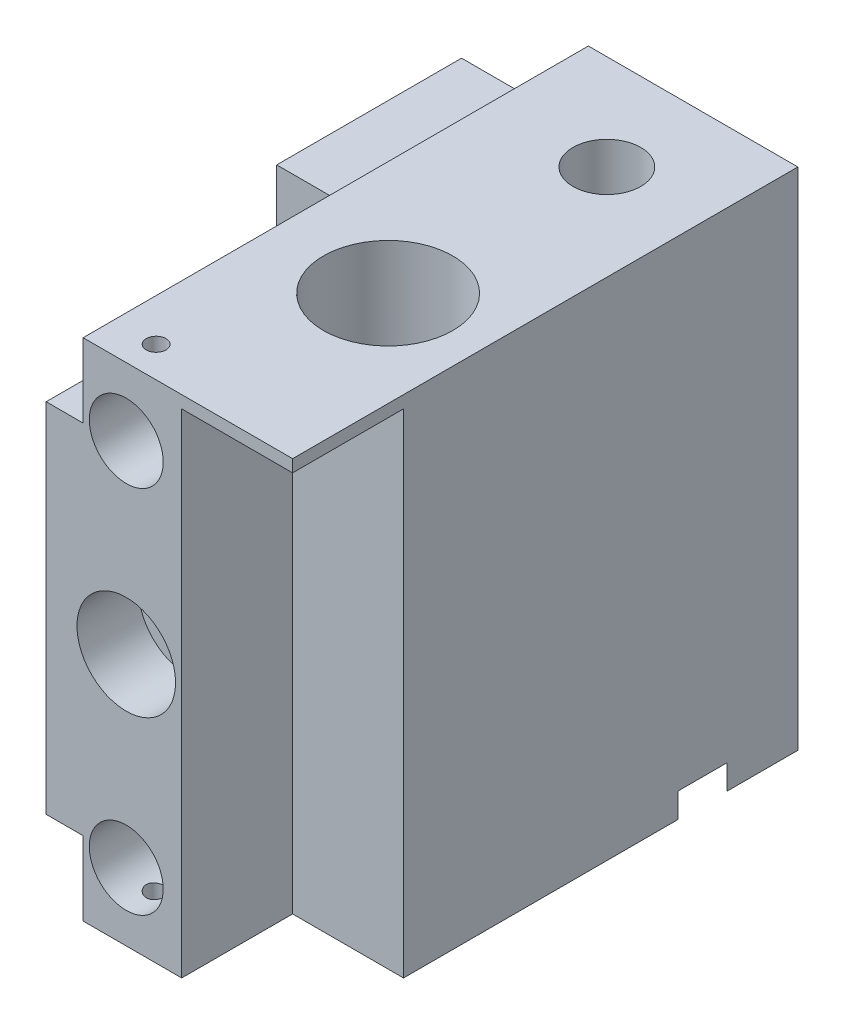
from build123d import *
from build123d.topology import SkipClean

# Parameters (mm, degrees)
SKETCH1_W           = 40
SKETCH1_H           = 82
SKETCH1_R           = 5.5
SKETCH1_R_2         = 6
BOSS_EXTRUDE1_DEPTH = 12
BOSS_EXTRUDE2_START = 70
SKETCH2_W           = 40
SKETCH2_H           = 82
SKETCH2_R           = 5.5
BOSS_EXTRUDE2_DEPTH = 70
SKETCH3_R           = 1.6
CUT_EXTRUDE1_DEPTH  = 10
CUT_EXTRUDE2_START  = -10
SKETCH4_R           = 1.6
CUT_EXTRUDE2_DEPTH  = 10
SKETCH5_R           = 10.5
SKETCH5_R_2         = 5.5
CUT_EXTRUDE3_DEPTH  = 100
SKETCH6_R           = 16
CUT_EXTRUDE4_DEPTH  = 4
SKETCH19_R          = 8.05
CUT_EXTRUDE17_DEPTH = 16
SKETCH12_R          = 1.2
CUT_EXTRUDE12_DEPTH = 12
SKETCH13_W          = 20
SKETCH13_H          = 70
BOSS_EXTRUDE3_DEPTH = 30
CUT_EXTRUDE14_DEPTH = 115
SKETCH22_W          = 18
SKETCH22_H          = 18
CUT_EXTRUDE18_DEPTH = 80
SKETCH23_R          = 8
CUT_EXTRUDE19_DEPTH = 10
SKETCH24_R          = 10
CUT_EXTRUDE20_DEPTH = 2
SKETCH25_R          = 2.5
CUT_EXTRUDE21_DEPTH = 25


with BuildPart() as part:
    # Sketch1 → Boss-Extrude1 (new body)
    with BuildSketch(Plane.XY):
        with Locations((-20, -41)):
            Rectangle(SKETCH1_W, SKETCH1_H)
        with Locations((-27, -41)):
            Circle(SKETCH1_R, mode=Mode.SUBTRACT)
        with Locations((-27, -11)):
            Circle(SKETCH1_R_2, mode=Mode.SUBTRACT)
        with Locations((-27, -71)):
            Circle(SKETCH1_R_2, mode=Mode.SUBTRACT)
    extrude(amount=BOSS_EXTRUDE1_DEPTH)

    # Sketch2 → Boss-Extrude2 (add)
    with SkipClean():  # the faces are left unmerged after this step: merging them gives an invalid solid
        with BuildSketch(Plane(origin=(0, 0, 0), x_dir=(-1, 0, 0), z_dir=(0, 0, -1)).offset(BOSS_EXTRUDE2_START)):
            with Locations((20, -41)):
                Rectangle(SKETCH2_W, SKETCH2_H)
            with Locations((27, -41)):
                Circle(SKETCH2_R, mode=Mode.SUBTRACT)
        extrude(amount=-BOSS_EXTRUDE2_DEPTH)

    # Sketch3 → Cut-Extrude1 (cut)
    with SkipClean():  # the faces are left unmerged after this step: merging them gives an invalid solid
        with BuildSketch(Plane(origin=(0, 0, 0), x_dir=(1, 0, 0), z_dir=(0, 1, 0))):
            with Locations((-27.154767421, -7)):
                Circle(SKETCH3_R)
        extrude(amount=-CUT_EXTRUDE1_DEPTH, mode=Mode.SUBTRACT)

    # Sketch4 → Cut-Extrude2 (cut)
    with SkipClean():  # the faces are left unmerged after this step: merging them gives an invalid solid
        with BuildSketch(Plane.XZ.offset(82).offset(CUT_EXTRUDE2_START)):
            with Locations((-27.154767421, 7)):
                Circle(SKETCH4_R)
        extrude(amount=CUT_EXTRUDE2_DEPTH, mode=Mode.SUBTRACT)

    # Sketch5 → Cut-Extrude3 (cut)
    with SkipClean():  # the faces are left unmerged after this step: merging them gives an invalid solid
        with BuildSketch(Plane(origin=(0, 0, 0), x_dir=(1, 0, 0), z_dir=(0, 1, 0))):
            with Locations((-15.5, 19)):
                Circle(SKETCH5_R)
            with Locations((-15.5, 54.5)):
                Circle(SKETCH5_R_2)
        extrude(amount=-CUT_EXTRUDE3_DEPTH, mode=Mode.SUBTRACT)

    # Sketch6 → Cut-Extrude4 (cut)
    with SkipClean():  # the faces are left unmerged after this step: merging them gives an invalid solid
        with BuildSketch(Plane(origin=(0, -82, 0), x_dir=(1, 0, 0), z_dir=(0, 1, 0))):
            with Locations((-15.5, 54.5)):
                Circle(SKETCH6_R)
        extrude(amount=CUT_EXTRUDE4_DEPTH, mode=Mode.SUBTRACT)

    # Sketch19 → Cut-Extrude17 (cut)
    with SkipClean():  # the faces are left unmerged after this step: merging them gives an invalid solid
        with BuildSketch(Plane(origin=(0, -78, 0), x_dir=(-1, 0, 0), z_dir=(0, -1, 0))):
            with Locations((15.5, 54.5)):
                Circle(SKETCH19_R)
        extrude(amount=-CUT_EXTRUDE17_DEPTH, mode=Mode.SUBTRACT)

    # Sketch12 → Cut-Extrude12 (cut)
    with SkipClean():  # the faces are left unmerged after this step: merging them gives an invalid solid
        with BuildSketch(Plane(origin=(0, -78, 0), x_dir=(-1, 0, 0), z_dir=(0, -1, 0))):
            with Locations((11.517229373, 43.180214749)):
                Circle(SKETCH12_R)
            with Locations((26.819785251, 50.517229373)):
                Circle(SKETCH12_R)
            with Locations((19.482770627, 65.819785251)):
                Circle(SKETCH12_R)
            with Locations((4.180214749, 58.482770627)):
                Circle(SKETCH12_R)
        extrude(amount=-CUT_EXTRUDE12_DEPTH, mode=Mode.SUBTRACT)

    # Sketch13 → Boss-Extrude3 (add)
    with SkipClean():  # the faces are left unmerged after this step: merging them gives an invalid solid
        with BuildSketch(Plane(origin=(0, 0, -70), x_dir=(-1, 0, 0), z_dir=(0, 0, -1))):
            with Locations((50, -35)):
                Rectangle(SKETCH13_W, SKETCH13_H)
        extrude(amount=-BOSS_EXTRUDE3_DEPTH)

    # Sketch15 → Cut-Extrude14 (cut)
    with SkipClean():  # the faces are left unmerged after this step: merging them gives an invalid solid
        with BuildSketch(Plane(origin=(0, 0, -70), x_dir=(-1, 0, 0), z_dir=(0, 0, -1))):
            Polygon((34, 0), (34, -12), (54.581085422, -12), (54.581085422, -70), (34, -70), (34, -82), (77.520554958, -82), (77.520554958, 0), align=None)
        extrude(amount=-CUT_EXTRUDE14_DEPTH, mode=Mode.SUBTRACT)

    # Sketch22 → Cut-Extrude18 (cut)
    with SkipClean():  # the faces are left unmerged after this step: merging them gives an invalid solid
        with BuildSketch(Plane.XZ.offset(82)):
            with Locations((-9, 3)):
                Rectangle(SKETCH22_W, SKETCH22_H)
        extrude(amount=-CUT_EXTRUDE18_DEPTH, mode=Mode.SUBTRACT)

    # Sketch23 → Cut-Extrude19 (cut)
    with SkipClean():  # the faces are left unmerged after this step: merging them gives an invalid solid
        with BuildSketch(Plane.XY.offset(12)):
            with Locations((-27, -41)):
                Circle(SKETCH23_R)
        extrude(amount=-CUT_EXTRUDE19_DEPTH, mode=Mode.SUBTRACT)

    # Sketch24 → Cut-Extrude20 (cut)
    with BuildSketch(Plane(origin=(0, 0, -70), x_dir=(-1, 0, 0), z_dir=(0, 0, -1))):
        with Locations((27, -41)):
            Circle(SKETCH24_R)
    extrude(amount=-CUT_EXTRUDE20_DEPTH, mode=Mode.SUBTRACT)

    # Sketch25 → Cut-Extrude21 (cut)
    with BuildSketch(Plane(origin=(0, 0, -70), x_dir=(-1, 0, 0), z_dir=(0, 0, -1))):
        with Locations((3.5, -17.5)):
            Circle(SKETCH25_R)
        with Locations((50.5, -17.5)):
            Circle(SKETCH25_R)
        with Locations((50.5, -64.5)):
            Circle(SKETCH25_R)
        with Locations((3.5, -64.5)):
            Circle(SKETCH25_R)
    extrude(amount=-CUT_EXTRUDE21_DEPTH, mode=Mode.SUBTRACT)


solid = part.part
